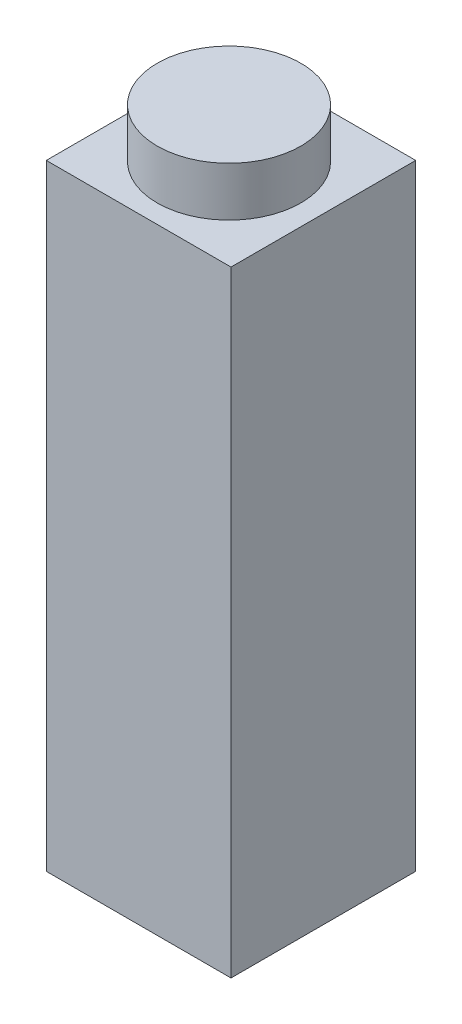
from build123d import *

# Parameters (mm, degrees)
SKETCH1_W           = 4.5
SKETCH1_H           = 4.5
BOSS_EXTRUDE1_DEPTH = 15
SKETCH2_R           = 1
CUT_EXTRUDE1_DEPTH  = 0.5
SKETCH4_R           = 1.75
BOSS_EXTRUDE2_DEPTH = 1.2


with BuildPart() as part:
    # Sketch1 → Boss-Extrude1 (new body)
    with BuildSketch(Plane(origin=(0, 0, 0), x_dir=(1, 0, 0), z_dir=(0, 1, 0))):
        Rectangle(SKETCH1_W, SKETCH1_H)
    extrude(amount=BOSS_EXTRUDE1_DEPTH)

    # Sketch2 → Cut-Extrude1 (cut)
    with BuildSketch(Plane.XZ):
        Circle(SKETCH2_R)
    extrude(amount=-CUT_EXTRUDE1_DEPTH, mode=Mode.SUBTRACT)

    # Sketch4 → Boss-Extrude2 (add)
    with BuildSketch(Plane(origin=(0, 15, 0), x_dir=(1, 0, 0), z_dir=(0, 1, 0))):
        with Locations((0, -0.04771887)):
            Circle(SKETCH4_R)
    extrude(amount=BOSS_EXTRUDE2_DEPTH)


solid = part.part
